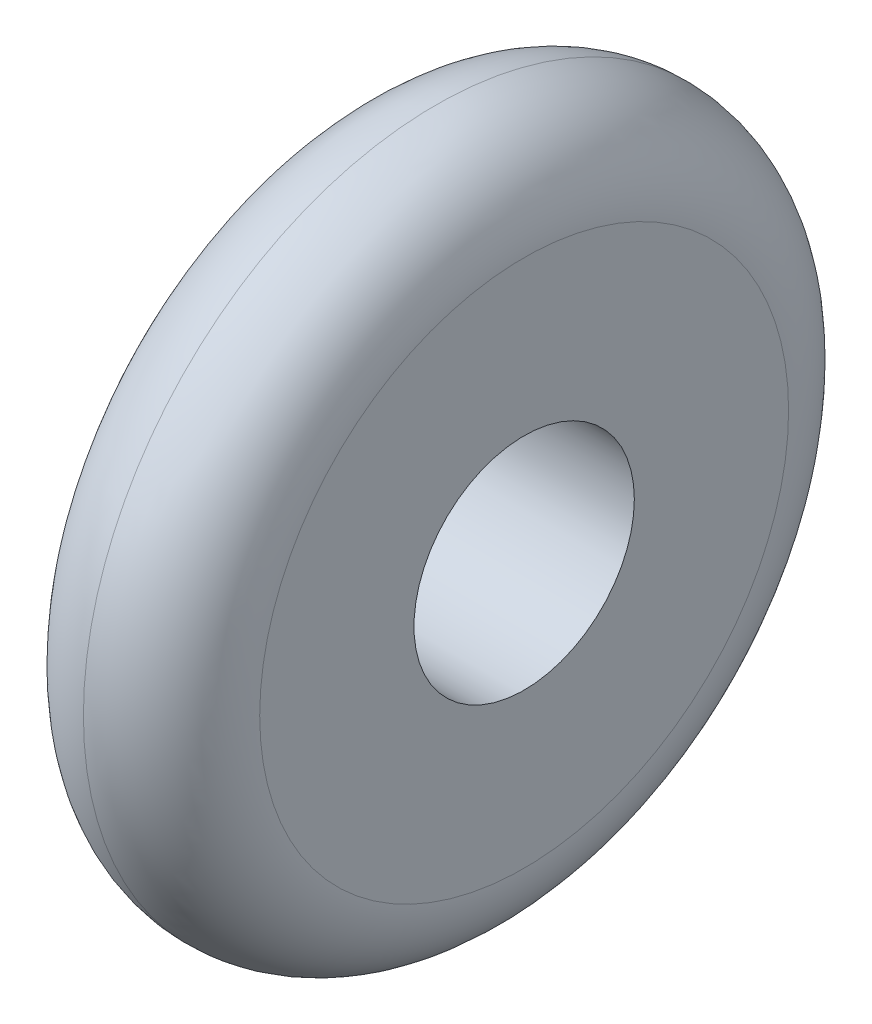
from build123d import *

# Parameters (mm, degrees)
SKETCH1_R           = 40
BOSS_EXTRUDE1_DEPTH = 20
FILLET2_R           = 10
SKETCH2_R           = 12.5
CUT_EXTRUDE1_DEPTH  = 20


with BuildPart() as part:
    # Sketch1 → Boss-Extrude1 (new body)
    with BuildSketch(Plane(origin=(0, 0, 0), x_dir=(0, 0, -1), z_dir=(1, 0, 0))):
        Circle(SKETCH1_R)
    extrude(amount=BOSS_EXTRUDE1_DEPTH)

    # Fillet2
    fillet2_edges = [part.edges().sort_by_distance(p)[0] for p in [
        (0, 0, 40),
        (20, 0, 40),
    ]]
    fillet(fillet2_edges, radius=FILLET2_R - 0.0001)  # a hair under: the kernel refuses the full size

    # Sketch2 → Cut-Extrude1 (cut)
    with BuildSketch(Plane(origin=(20, 0, 0), x_dir=(0, 0, -1), z_dir=(1, 0, 0))):
        Circle(SKETCH2_R)
    extrude(amount=-CUT_EXTRUDE1_DEPTH, mode=Mode.SUBTRACT)


solid = part.part
